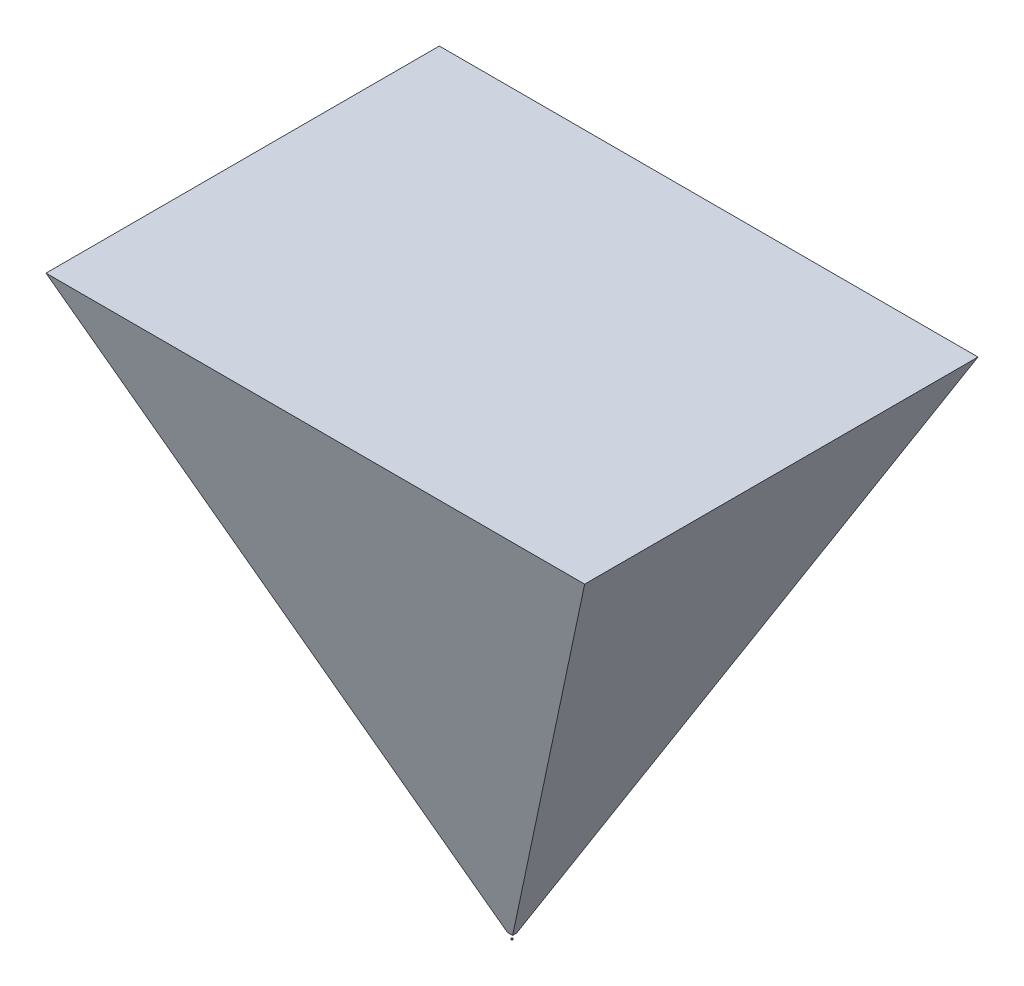
from build123d import *

# Parameters (mm, degrees)
SKIZZE4_W             = 0.25
SKIZZE4_H             = 1
TOOLFACE_ANGLE        = 60
KREISMUSTER1_COUNT    = 3
FOV_3_6MM_F_2_9_DEPTH = 1500
FOV2_DEPTH            = 2621.25371886
FOV2_DEPTH_BACK       = 2621.25371886
SKIZZE8_OUTSIDE_W     = 3782.966
SKIZZE8_OUTSIDE_H     = 2804.224
SKIZZE8_OUTSIDE_R     = 5


with BuildPart() as part:
    # Skizze3 → Body (revolve)
    with BuildSketch(Plane.XY):
        with BuildLine():
            Line((1, 0.8), (2.75, 0.8))
            Line((2.75, 0.8), (2.75, -2.55))
            Line((2.75, -2.55), (2.1, -2.55))
            Line((2.1, -2.55), (1.8, -2.25))
            ThreePointArc((1.8, -2.25), (0.91241438, -2.474486277), (0, -2.55))
            Line((0, -2.55), (0, 0.525))
            ThreePointArc((0, 0.525), (0.316474723, 0.499842016), (0.625, 0.425))
            Line((0.625, 0.425), (1, 0.8))
        make_face()
    revolve(axis=Axis((0, 0, 0), (0, -1, 0)))

    # Skizze4 → Thread (revolve)
    with BuildSketch(Plane.XY):
        with Locations((2.875, -0.7)):
            Rectangle(SKIZZE4_W, SKIZZE4_H)
    revolve(axis=Axis((0, 0, 0), (0, 1, 0)))

    # Skizze5 → Toolface (revolve, cut)
    with BuildSketch(Plane(origin=(0, 0, 0), x_dir=(0, 0, -1), z_dir=(1, 0, 0))):
        Polygon((2.75, 0.8), (2.75, 0.35), (2.3, 0.8), align=None)
    toolface = revolve(axis=Axis((0, 0, 0), (0, -1, 0)), revolution_arc=TOOLFACE_ANGLE, mode=Mode.SUBTRACT)

    # Kreismuster1: Toolface ×3 about axis
    kreismuster1_axis = Axis((0, 0, 0), (0, 1, 0))
    for i in range(1, KREISMUSTER1_COUNT):
        add(toolface.rotate(kreismuster1_axis, i * 360 / KREISMUSTER1_COUNT), mode=Mode.SUBTRACT)


with BuildPart() as body_2:
    # Skizze6 → FOV - 3,6mm f/2,9 (new, symmetric)
    with BuildSketch(Plane(origin=(0, 0, 0), x_dir=(0, 0, -1), z_dir=(1, 0, 0))):
        Polygon((-7.279404685, 18.707826613), (-735.219873218, 2018.707826613), (735.219873218, 2018.707826613), (7.279404685, 18.707826613), align=None)
    extrude(amount=FOV_3_6MM_F_2_9_DEPTH, both=True)

    # Skizze8 outside → FOV2 (cut, two sides: drawn at the far end of the back side and taken through both)
    with BuildSketch(Plane.XY.offset(-FOV2_DEPTH_BACK)):
        with Locations((0, 1008.079)):
            Rectangle(SKIZZE8_OUTSIDE_W, SKIZZE8_OUTSIDE_H)
        Circle(SKIZZE8_OUTSIDE_R, mode=Mode.SUBTRACT)
        Polygon((-9.740481092, 18.707826613), (-1006.903697199, 2018.707826613), (1006.903697199, 2018.707826613), (9.740481092, 18.707826613), align=None, mode=Mode.SUBTRACT)
    extrude(amount=FOV2_DEPTH + FOV2_DEPTH_BACK, mode=Mode.SUBTRACT)


solid = Compound([part.part, body_2.part])
